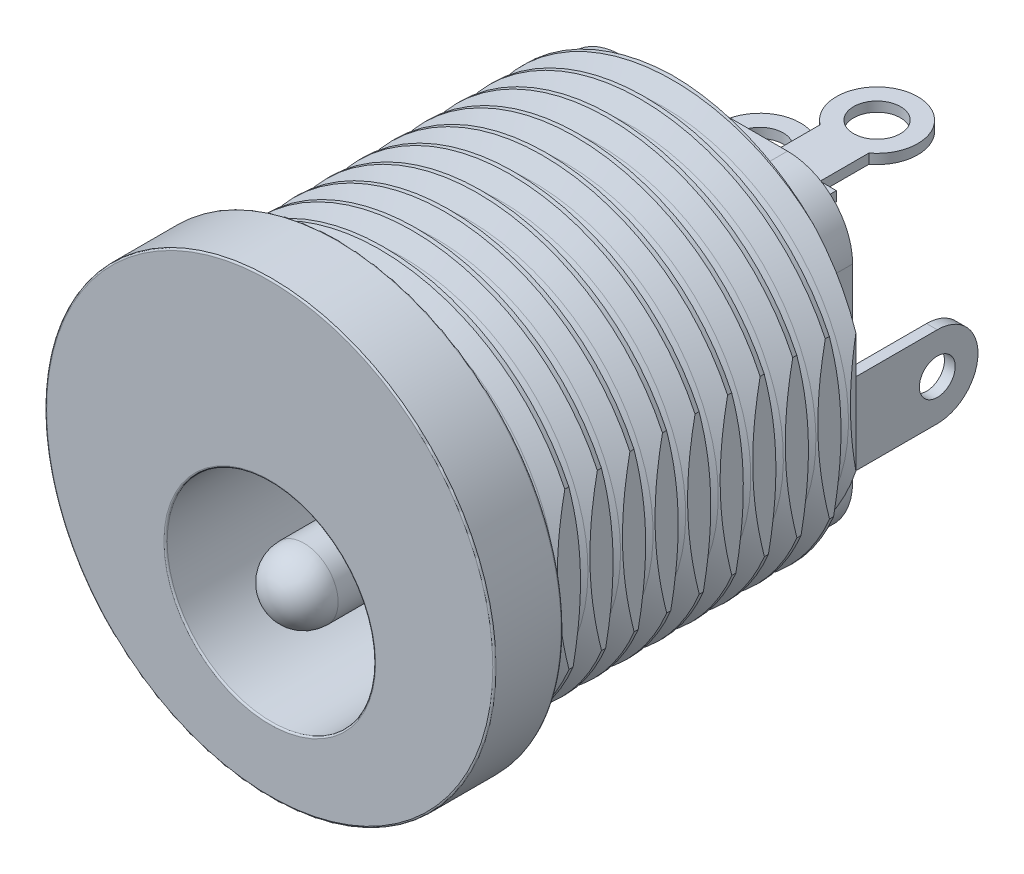
from build123d import *

# Parameters (mm, degrees)
SKETCH1_R             = 6.15
BOSS_EXTRUDE1_DEPTH   = 10.25
SKETCH2_R             = 6.9
BOSS_EXTRUDE2_DEPTH   = 2.1
SKETCH3_R             = 3.2
SKETCH3_R_2           = 1.05
CUT_EXTRUDE1_DEPTH    = 10.6
FILLET1_R             = 1.05
SKETCH4_OUTSIDE_W     = 20.42
SKETCH4_OUTSIDE_H     = 20.42
SKETCH4_OUTSIDE_W_2   = 11.3
SKETCH4_OUTSIDE_H_2   = 13.8
CUT_EXTRUDE2_DEPTH    = 15.152119983
BOSS_EXTRUDE3_DEPTH   = 1
BOSS_EXTRUDE4_DEPTH   = 1.75
FILLET2_RADIUS        = 1.75
FILLET2_LENGTH        = 0.33
CUT_EXTRUDE3_START    = -5.15
SKETCH7_W             = 0.5
SKETCH7_H             = 0.5
CUT_EXTRUDE3_DEPTH    = 5.15
FILLET3_RADIUS        = 1.25
FILLET3_LENGTH        = 0.33
SKETCH8_R             = 0.55
CUT_EXTRUDE4_DEPTH    = 21.226035202
SKETCH9_R             = 1.5
BOSS_EXTRUDE5_DEPTH   = 0.25
SKETCH10_W            = 2.5
SKETCH10_H            = 0.3
BOSS_EXTRUDE6_DEPTH   = 4.75
BOSS_EXTRUDE6_2_DEPTH = 4.75
SKETCH11_R            = 0.72
CUT_EXTRUDE5_DEPTH    = 0.3
SKETCH13_R            = 0.72
CUT_EXTRUDE6_DEPTH    = 0.3
SKETCH14_R            = 0.75
CUT_EXTRUDE7_DEPTH    = 0.5
CUT_SWEEP2_PITCH      = 1
FILLET4_R             = 0.05


with BuildPart() as part:
    # Sketch1 → Boss-Extrude1 (new body)
    with BuildSketch(Plane.XY):
        Circle(SKETCH1_R)
    extrude(amount=-BOSS_EXTRUDE1_DEPTH)

    # Sketch2 → Boss-Extrude2 (add)
    with BuildSketch(Plane.XY):
        Circle(SKETCH2_R)
    extrude(amount=BOSS_EXTRUDE2_DEPTH)

    # Sketch3 → Cut-Extrude1 (cut)
    with BuildSketch(Plane.XY.offset(2.1)):
        with Locations((0, -1.7)):
            Circle(SKETCH3_R)
        with Locations((0, -1.7)):
            Circle(SKETCH3_R_2, mode=Mode.SUBTRACT)
    extrude(amount=-CUT_EXTRUDE1_DEPTH, mode=Mode.SUBTRACT)

    # Fillet1
    fillet1_edges = [part.edges().sort_by_distance(p)[0] for p in [
        (-1.05, -1.7, 2.1),
    ]]
    fillet(fillet1_edges, radius=FILLET1_R)

    # Sketch4 outside → Cut-Extrude2 (cut, through all)
    with BuildSketch(Plane(origin=(0, 0, 0), x_dir=(-1, 0, 0), z_dir=(0, 0, -1))):
        Rectangle(SKETCH4_OUTSIDE_W, SKETCH4_OUTSIDE_H)
        Rectangle(SKETCH4_OUTSIDE_W_2, SKETCH4_OUTSIDE_H_2, mode=Mode.SUBTRACT)
    extrude(amount=CUT_EXTRUDE2_DEPTH, mode=Mode.SUBTRACT)

    # Cut-Sweep2: the profile of Sketch15 screwed along a right-hand helix of 10.25 turns, 8 arcs to a turn; built about Z, then put on its axis
    cut_sweep2_z = Axis((0, 0, 0), (0, 0, 1))
    cut_sweep2_corners = [(6.15, 0, 0), (5.6086244, 0, -0.312563348), (5.3921148, 0, -0.437565224), (5.6086244, 0, -0.5625671), (6.15, 0, -0.875130448), (6.2582548, 0, -0.875130448), (6.2582548, 0, 0)]
    with BuildLine(mode=Mode.PRIVATE) as cut_sweep2_profile:
        Line(cut_sweep2_corners[0], cut_sweep2_corners[1])
        Line(cut_sweep2_corners[1], cut_sweep2_corners[2])
        Line(cut_sweep2_corners[2], cut_sweep2_corners[3])
        Line(cut_sweep2_corners[3], cut_sweep2_corners[4])
        Line(cut_sweep2_corners[4], cut_sweep2_corners[5])
        Line(cut_sweep2_corners[5], cut_sweep2_corners[6])
        Line(cut_sweep2_corners[6], cut_sweep2_corners[0])
    cut_sweep2_cap = Face(cut_sweep2_profile.wire())
    cut_sweep2_turn_angles = [0, 22.5, 45, 67.5, 90, 112.5, 135, 157.5, 180, 202.5, 225, 247.5, 270, 292.5, 315, 337.5, 360]
    cut_sweep2_turn_weights = [1, 0.9238795325112867, 1, 0.9238795325112867, 1, 0.9238795325112867, 1, 0.9238795325112867, 1, 0.9238795325112867, 1, 0.9238795325112867, 1, 0.9238795325112867, 1, 0.9238795325112867, 1]
    cut_sweep2_turn_rails = [Edge.make_bspline([Vector(p[0], p[1], 0).rotate(cut_sweep2_z, cut_sweep2_turn_angles[k]) / cut_sweep2_turn_weights[k] + Vector(0, 0, p[2] + CUT_SWEEP2_PITCH * cut_sweep2_turn_angles[k] / 360) for k in range(17)], [0, 0, 0, 1, 1, 2, 2, 3, 3, 4, 4, 5, 5, 6, 6, 7, 7, 8, 8, 8], 2, cut_sweep2_turn_weights) for p in cut_sweep2_corners]
    cut_sweep2_turn_sides = [Face.make_surface_from_curves(cut_sweep2_turn_rails[p[0]], cut_sweep2_turn_rails[p[1]]) for p in [(0, 1), (1, 2), (2, 3), (3, 4), (4, 5), (5, 6), (6, 0)]]
    cut_sweep2_last_angles = [3600, 3622.5, 3645, 3667.5, 3690]
    cut_sweep2_last_weights = [1, 0.9238795325112867, 1, 0.9238795325112701, 1]
    cut_sweep2_last_rails = [Edge.make_bspline([Vector(p[0], p[1], 0).rotate(cut_sweep2_z, cut_sweep2_last_angles[k]) / cut_sweep2_last_weights[k] + Vector(0, 0, p[2] + CUT_SWEEP2_PITCH * cut_sweep2_last_angles[k] / 360) for k in range(5)], [0, 0, 0, 1, 1, 2, 2, 2], 2, cut_sweep2_last_weights) for p in cut_sweep2_corners]
    cut_sweep2_last_sides = [Face.make_surface_from_curves(cut_sweep2_last_rails[p[0]], cut_sweep2_last_rails[p[1]]) for p in [(0, 1), (1, 2), (2, 3), (3, 4), (4, 5), (5, 6), (6, 0)]]
    cut_sweep2 = Plane(origin=(0, 0, -10.25), x_dir=(0, 1, 0), z_dir=(0, 0, 1)) * Solid(Shell([*[p.moved(Location((0, 0, CUT_SWEEP2_PITCH * i))) for i in range(10) for p in cut_sweep2_turn_sides], *cut_sweep2_last_sides, cut_sweep2_cap, cut_sweep2_cap.rotate(cut_sweep2_z, 3690).moved(Location((0, 0, CUT_SWEEP2_PITCH * 3690 / 360)))]))
    add(cut_sweep2, mode=Mode.SUBTRACT)

    # Fillet4
    fillet4_edges = [part.edges().sort_by_distance(p)[0] for p in [
        (-3.2, -1.7, 2.1),
        (-6.9, 0, 0),
        (-6.9, 0, 0),
        (-6.9, 0, 2.1),
    ]]
    fillet(fillet4_edges, radius=FILLET4_R)


with BuildPart() as body_2:
    # Sketch5 → Boss-Extrude3 (new body)
    with BuildSketch(Plane(origin=(0, 0, -10.25), x_dir=(-1, 0, 0), z_dir=(0, 0, -1))):
        with BuildLine():
            Line((-2.55, -4.9), (2.55, -4.9))
            ThreePointArc((2.55, -4.9), (3.964213562, -4.314213562), (4.55, -2.9))
            Line((4.55, -2.9), (4.55, 2.9))
            ThreePointArc((4.55, 2.9), (3.964213562, 4.314213562), (2.55, 4.9))
            Line((2.55, 4.9), (-2.55, 4.9))
            ThreePointArc((-2.55, 4.9), (-3.964213562, 4.314213562), (-4.55, 2.9))
            Line((-4.55, 2.9), (-4.55, -2.9))
            ThreePointArc((-4.55, -2.9), (-3.964213562, -4.314213562), (-2.55, -4.9))
        make_face()
    extrude(amount=BOSS_EXTRUDE3_DEPTH)


with BuildPart() as body_3:
    # Sketch6 → Boss-Extrude4 (new, symmetric)
    with BuildSketch(Plane(origin=(0, -1.7, 0), x_dir=(1, 0, 0), z_dir=(0, 1, 0))):
        Polygon((-1.75, 11.58), (-1.75, 11.25), (4.25, 11.25), (4.25, 15.4), (3.92, 15.4), (3.92, 11.58), align=None)
    extrude(amount=BOSS_EXTRUDE4_DEPTH, both=True)

    # Fillet2: full round fillet: the end face becomes a half cylinder, R = half its width
    fillet2_face = Plane((-1.75, -1.7, -11.415), x_dir=(0, 0, -1), z_dir=(-1, 0, 0))  # on the end face: x along it, z out of the body
    fillet2_slab = fillet2_face.offset(-FILLET2_RADIUS / 2) * Box(FILLET2_LENGTH, 2 * FILLET2_RADIUS, FILLET2_RADIUS, mode=Mode.PRIVATE)  # the body's end, R deep
    fillet2_round = Plane((0, -1.7, -11.415), x_dir=(-1, 0, 0), z_dir=(0, 0, -1)) * Cylinder(FILLET2_RADIUS, FILLET2_LENGTH, mode=Mode.PRIVATE)  # its axis R under the face
    add(fillet2_slab - fillet2_round, mode=Mode.SUBTRACT)

    # Sketch7 → Cut-Extrude3 (cut)
    with BuildSketch(Plane(origin=(0, 0, -15.4), x_dir=(-1, 0, 0), z_dir=(0, 0, -1)).offset(CUT_EXTRUDE3_START)):
        with Locations((-4, -0.2)):
            Rectangle(SKETCH7_W, SKETCH7_H)
        with Locations((-4, -3.2)):
            Rectangle(SKETCH7_W, SKETCH7_H)
    extrude(amount=CUT_EXTRUDE3_DEPTH, mode=Mode.SUBTRACT)

    # Fillet3: full round fillet: the end face becomes a half cylinder, R = half its width
    fillet3_face = Plane((4.085, -1.7, -15.4), x_dir=(1, 0, 0), z_dir=(0, 0, -1))  # on the end face: x along it, z out of the body
    fillet3_slab = fillet3_face.offset(-FILLET3_RADIUS / 2) * Box(FILLET3_LENGTH, 2 * FILLET3_RADIUS, FILLET3_RADIUS, mode=Mode.PRIVATE)  # the body's end, R deep
    fillet3_round = Plane((4.085, -1.7, -14.15), x_dir=(0, 0, -1), z_dir=(1, 0, 0)) * Cylinder(FILLET3_RADIUS, FILLET3_LENGTH, mode=Mode.PRIVATE)  # its axis R under the face
    add(fillet3_slab - fillet3_round, mode=Mode.SUBTRACT)

    # Sketch8 → Cut-Extrude4 (cut, through all)
    with BuildSketch(Plane(origin=(4.25, 0, 0), x_dir=(0, 0, -1), z_dir=(1, 0, 0))):
        with Locations((14.15, -1.7)):
            Circle(SKETCH8_R)
    extrude(amount=-CUT_EXTRUDE4_DEPTH, mode=Mode.SUBTRACT)

    # Sketch9 → Boss-Extrude5 (add)
    with BuildSketch(Plane(origin=(0, 0, -11.58), x_dir=(-1, 0, 0), z_dir=(0, 0, -1))):
        with Locations(Location((0, -1.7, 0), (0, 0, 180))):
            Circle(SKETCH9_R)
    extrude(amount=BOSS_EXTRUDE5_DEPTH)

    # Sketch14 → Cut-Extrude7 (cut)
    with BuildSketch(Plane(origin=(0, 0, -11.83), x_dir=(-1, 0, 0), z_dir=(0, 0, -1))):
        with Locations((0, -1.7)):
            Circle(SKETCH14_R)
    extrude(amount=-CUT_EXTRUDE7_DEPTH, mode=Mode.SUBTRACT)


with BuildPart() as body_4:
    # Sketch10 → Boss-Extrude6 (new body)
    with BuildSketch(Plane(origin=(0, 0, -11.25), x_dir=(-1, 0, 0), z_dir=(0, 0, -1))):
        with Locations((1.8, 0.95)):
            Rectangle(SKETCH10_W, SKETCH10_H)
    extrude(amount=BOSS_EXTRUDE6_DEPTH)

    # Sketch13 → Cut-Extrude6 (cut)
    with BuildSketch(Plane(origin=(-3.6, 1.1, 0), x_dir=(1, 0, 0), z_dir=(0, 1, 0))):
        with Locations(Location((1.8, 14.75, 0), (0, 0, 180))):
            Circle(SKETCH13_R)
        with BuildLine():
            Line((0.55, 12.25), (1.05, 12.25))
            Line((1.05, 12.25), (1.05, 13.75))
            ThreePointArc((1.05, 13.75), (1.8, 16), (2.55, 13.75))
            Line((2.55, 13.75), (2.55, 12.25))
            Line((2.55, 12.25), (3.05, 12.25))
            Line((3.05, 12.25), (3.55, 12.25))
            Line((3.55, 12.25), (3.55, 17.712605724))
            Line((3.55, 17.712605724), (0.05, 17.712605724))
            Line((0.05, 17.712605724), (0.05, 12.25))
            Line((0.05, 12.25), (0.55, 12.25))
        make_face()
    extrude(amount=-CUT_EXTRUDE6_DEPTH, mode=Mode.SUBTRACT)


with BuildPart() as body_5:
    # Sketch10 → Boss-Extrude6 2 (new body)
    with BuildSketch(Plane(origin=(0, 0, -11.25), x_dir=(-1, 0, 0), z_dir=(0, 0, -1))):
        with Locations((-1.8, 3.45)):
            Rectangle(SKETCH10_W, SKETCH10_H)
    extrude(amount=BOSS_EXTRUDE6_2_DEPTH)

    # Sketch11 → Cut-Extrude5 (cut)
    with BuildSketch(Plane(origin=(0, 3.6, 0), x_dir=(1, 0, 0), z_dir=(0, 1, 0))):
        with Locations(Location((1.8, 14.75, 0), (0, 0, 180))):
            Circle(SKETCH11_R)
        with BuildLine():
            Line((0.55, 12.25), (1.05, 12.25))
            Line((1.05, 12.25), (1.05, 13.75))
            ThreePointArc((1.05, 13.75), (1.8, 16), (2.55, 13.75))
            Line((2.55, 13.75), (2.55, 12.25))
            Line((2.55, 12.25), (3.05, 12.25))
            Line((3.05, 12.25), (3.55, 12.25))
            Line((3.55, 12.25), (3.55, 17.712605724))
            Line((3.55, 17.712605724), (0.05, 17.712605724))
            Line((0.05, 17.712605724), (0.05, 12.25))
            Line((0.05, 12.25), (0.55, 12.25))
        make_face()
    extrude(amount=-CUT_EXTRUDE5_DEPTH, mode=Mode.SUBTRACT)


solid = Compound([part.part, body_2.part, body_3.part, body_4.part, body_5.part])
